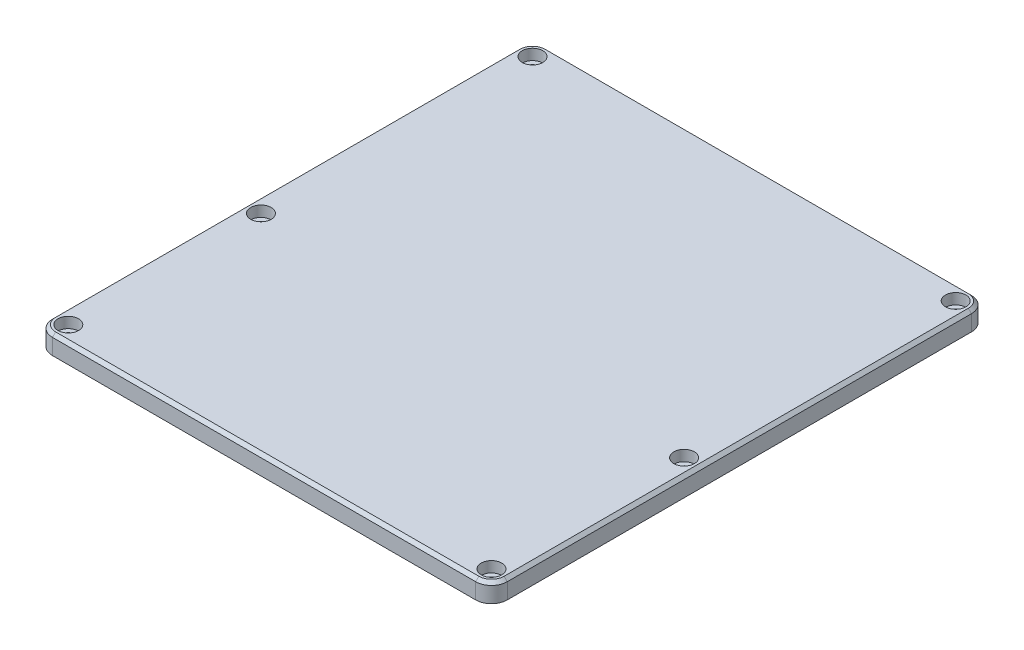
from build123d import *

# Parameters (mm, degrees)
SKETCH_1_W                   = 144
SKETCH_1_H                   = 157
EXTRUDE_1_DEPTH              = 6
FILLET_1_R                   = 5
SHELL_1_T                    = -3
EXTRUDE_2_DEPTH              = 6
HOLE_WIZARD_M3_1_D           = 3.4
HOLE_WIZARD_M3_1_CBORE_D     = 6.5
HOLE_WIZARD_M3_1_CBORE_DEPTH = 3.4
CHAMFER_1_SIZE               = 1
FILLET_4_R                   = 2


with BuildPart() as part:
    # 草图1 → 凸台-拉伸1 (new body)
    with BuildSketch(Plane(origin=(0, 0, 0), x_dir=(1, 0, 0), z_dir=(0, 1, 0))):
        Rectangle(SKETCH_1_W, SKETCH_1_H)
    extrude(amount=EXTRUDE_1_DEPTH)

    # 圆角1
    fillet_1_edges = [part.edges().sort_by_distance(p)[0] for p in [
        (72, 3, 78.5),
        (-72, 3, 78.5),
        (-72, 3, -78.5),
        (72, 3, -78.5),
    ]]
    fillet(fillet_1_edges, radius=FILLET_1_R)

    # 抽壳1
    shell_1_openings = [part.faces().sort_by_distance(p)[0] for p in [
        (0, 0, 0),
    ]]
    offset(amount=SHELL_1_T, openings=shell_1_openings, kind=Kind.INTERSECTION)

    # 草图3 → 凸台-拉伸2 (add)
    with BuildSketch(Plane(origin=(0, 6, 0), x_dir=(1, 0, 0), z_dir=(0, 1, 0))):
        with BuildLine():
            Line((-62, 73.5), (-62, 77.035533906))
            Line((-62, 77.035533906), (-70.535533906, 77.035533906))
            Line((-70.535533906, 77.035533906), (-70.535533906, 68.5))
            Line((-70.535533906, 68.5), (-67, 68.5))
            ThreePointArc((-67, 68.5), (-63.464466094, 69.964466094), (-62, 73.5))
        make_face()
        with BuildLine():
            Line((-67, -7.5), (-72, -7.5))
            Line((-72, -7.5), (-72, -17.5))
            Line((-72, -17.5), (-67, -17.5))
            ThreePointArc((-67, -17.5), (-62, -12.5), (-67, -7.5))
        make_face()
        with BuildLine():
            Line((72, -7.5), (72, -17.5))
            Line((72, -17.5), (67, -17.5))
            ThreePointArc((67, -17.5), (62, -12.5), (67, -7.5))
            Line((67, -7.5), (72, -7.5))
        make_face()
        with BuildLine():
            Line((70.535533906, 68.5), (67, 68.5))
            ThreePointArc((67, 68.5), (63.464466094, 69.964466094), (62, 73.5))
            Line((62, 73.5), (62, 77.035533906))
            Line((62, 77.035533906), (70.535533906, 77.035533906))
            Line((70.535533906, 77.035533906), (70.535533906, 68.5))
        make_face()
        with BuildLine():
            Line((62, -73.5), (62, -77.035533906))
            Line((62, -77.035533906), (70.535533906, -77.035533906))
            Line((70.535533906, -77.035533906), (70.535533906, -68.5))
            Line((70.535533906, -68.5), (67, -68.5))
            ThreePointArc((67, -68.5), (63.464466094, -69.964466094), (62, -73.5))
        make_face()
        with BuildLine():
            Line((-62, -73.5), (-62, -77.035533906))
            Line((-62, -77.035533906), (-70.535533906, -77.035533906))
            Line((-70.535533906, -77.035533906), (-70.535533906, -68.5))
            Line((-70.535533906, -68.5), (-67, -68.5))
            ThreePointArc((-67, -68.5), (-63.464466094, -69.964466094), (-62, -73.5))
        make_face()
    extrude(amount=-EXTRUDE_2_DEPTH)

    # M3 六角凹头螺钉的柱形沉头孔1 (through all)
    with Locations(Plane(origin=(0, 6, 0), x_dir=(-1, 0, 0), z_dir=(0, 1, 0))):
        with Locations((67, 12.5), (67, -73.5), (-67, -73.5), (-67, 12.5), (-67, 73.5), (67, 73.5)):
            CounterBoreHole(HOLE_WIZARD_M3_1_D / 2, HOLE_WIZARD_M3_1_CBORE_D / 2, HOLE_WIZARD_M3_1_CBORE_DEPTH)

    # 倒角1
    chamfer_1_edges = [part.edges().sort_by_distance(p)[0] for p in [
        (72, 6, 0),
        (0, 6, 78.5),
        (0, 6, -78.5),
        (-72, 6, 0),
        (-70.535533906, 6, -77.035533906),
        (70.535533906, 6, -77.035533906),
        (-70.535533906, 6, 77.035533906),
        (70.535533906, 6, 77.035533906),
    ]]
    chamfer(chamfer_1_edges, length=CHAMFER_1_SIZE)

    # 圆角4
    fillet_4_edges = [part.edges().sort_by_distance(p)[0] for p in [
        (69, 1.5, -68.5),
        (62, 1.5, -75.5),
        (69, 1.5, 7.5),
        (69, 1.5, 17.5),
        (-69, 1.5, 17.5),
        (-62, 1.5, -75.5),
        (-69, 1.5, -68.5),
        (-69, 1.5, 7.5),
    ]]
    fillet(fillet_4_edges, radius=FILLET_4_R - 0.0001)  # a hair under: the kernel refuses the full size


solid = part.part
